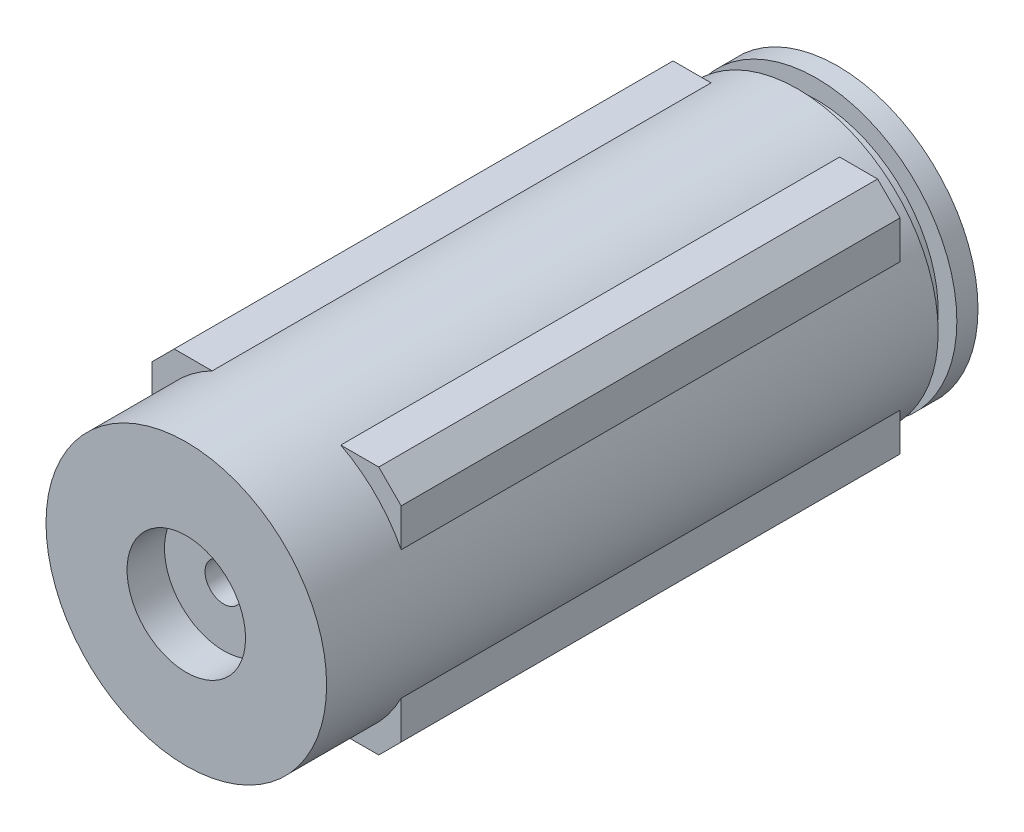
from build123d import *
from build123d.topology import SkipClean

# Parameters (mm, degrees)
EXTRUDE_1_DEPTH     = 80
EXTRUDE_START       = 10
SKETCH_4_R          = 22.5
EXTRUDE_2_DEPTH     = 10
SKETCH_6_R          = 22.5
EXTRUDE_3_DEPTH     = 14.46
CUT_EXTRUDE_START   = -3.39
SKETCH_7_R          = 22.5
SKETCH_7_R_2        = 19.5
CUT_EXTRUDE_4_DEPTH = 3
SKETCH_13_R         = 3
CUT_EXTRUDE_5_DEPTH = 100
SKETCH_14_R         = 9.5
CUT_EXTRUDE_6_DEPTH = 6
CUT_EXTRUDE_START_2 = -6
SKETCH_15_R         = 9.5
CUT_EXTRUDE_7_DEPTH = 6


with BuildPart() as part:
    # 草图1 → 凸台-拉伸1 (new body)
    with BuildSketch(Plane.XY):
        with BuildLine():
            Line((-16.4, 20), (-10.307764064, 20))
            ThreePointArc((-10.307764064, 20), (0, 22.5), (10.307764064, 20))
            Line((10.307764064, 20), (16.4, 20))
            Line((16.4, 20), (20, 16.4))
            Line((20, 16.4), (20, 10.307764064))
            ThreePointArc((20, 10.307764064), (22.5, 0), (20, -10.307764064))
            Line((20, -10.307764064), (20, -16.4))
            Line((20, -16.4), (16.4, -20))
            Line((16.4, -20), (10.307764064, -20))
            ThreePointArc((10.307764064, -20), (0, -22.5), (-10.307764064, -20))
            Line((-10.307764064, -20), (-16.4, -20))
            Line((-16.4, -20), (-20, -16.4))
            Line((-20, -16.4), (-20, -10.307764064))
            ThreePointArc((-20, -10.307764064), (-22.5, 0), (-20, 10.307764064))
            Line((-20, 10.307764064), (-20, 16.4))
            Line((-20, 16.4), (-16.4, 20))
        make_face()
    extrude(amount=EXTRUDE_1_DEPTH)

    # 草图4 → 凸台-拉伸2 (add)
    with BuildSketch(Plane(origin=(0, 0, 0), x_dir=(-1, 0, 0), z_dir=(0, 0, -1)).offset(EXTRUDE_START)):
        Circle(SKETCH_4_R)
    extrude(amount=-EXTRUDE_2_DEPTH)

    # 草图6 → 凸台-拉伸3 (add)
    with SkipClean():  # the faces are left unmerged after this step: merging them gives an invalid solid
        with BuildSketch(Plane.XY.offset(80)):
            Circle(SKETCH_6_R)
        extrude(amount=EXTRUDE_3_DEPTH)

    # 草图7 → 切除-拉伸4 (cut)
    with SkipClean():  # the faces are left unmerged after this step: merging them gives an invalid solid
        with BuildSketch(Plane(origin=(0, 0, -10), x_dir=(-1, 0, 0), z_dir=(0, 0, -1)).offset(CUT_EXTRUDE_START)):
            Circle(SKETCH_7_R)
            Circle(SKETCH_7_R_2, mode=Mode.SUBTRACT)
        extrude(amount=-CUT_EXTRUDE_4_DEPTH, mode=Mode.SUBTRACT)

    # 草图13 → 切除-拉伸5 (cut)
    with SkipClean():  # the faces are left unmerged after this step: merging them gives an invalid solid
        with BuildSketch(Plane(origin=(0, 0, -10), x_dir=(-1, 0, 0), z_dir=(0, 0, -1))):
            Circle(SKETCH_13_R)
        extrude(amount=-CUT_EXTRUDE_5_DEPTH, mode=Mode.SUBTRACT)

    # 草图14 → 切除-拉伸6 (cut)
    with SkipClean():  # the faces are left unmerged after this step: merging them gives an invalid solid
        with BuildSketch(Plane(origin=(0, 0, -10), x_dir=(-1, 0, 0), z_dir=(0, 0, -1))):
            Circle(SKETCH_14_R)
        extrude(amount=-CUT_EXTRUDE_6_DEPTH, mode=Mode.SUBTRACT)

    # 草图15 → 切除-拉伸7 (cut)
    with SkipClean():  # the faces are left unmerged after this step: merging them gives an invalid solid
        with BuildSketch(Plane.XY.offset(94.46).offset(CUT_EXTRUDE_START_2)):
            Circle(SKETCH_15_R)
        extrude(amount=CUT_EXTRUDE_7_DEPTH, mode=Mode.SUBTRACT)


solid = part.part
